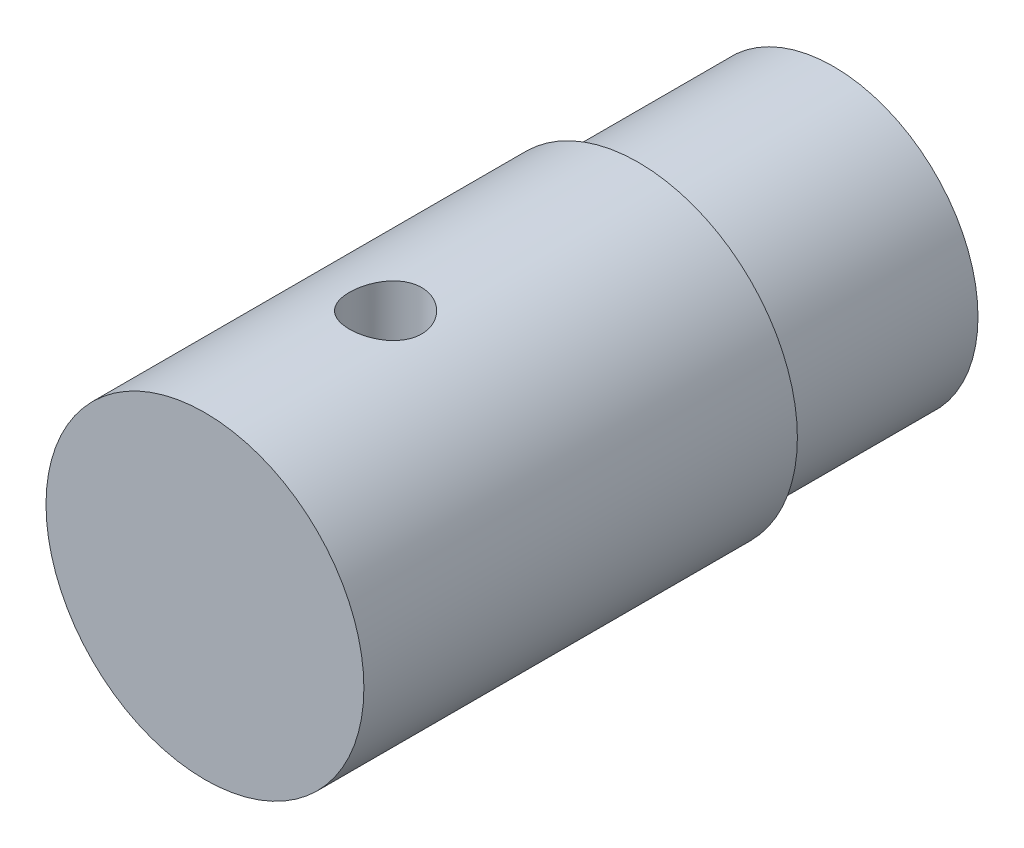
from build123d import *

# Parameters (mm, degrees)
SKETCH1_R                   = 10
BOSS_EXTRUDE1_DEPTH         = 13.5
SKETCH2_R                   = 11
BOSS_EXTRUDE2_DEPTH         = 30
CUT_EXTRUDE3_DEPTH          = 47.197943677
CUT_EXTRUDE3_DEPTH_BACK     = 47.197943677
SKETCH5_R                   = 2.5
SKETCH6_R                   = 2.5
SKETCH6_R_2                 = 2
BOSS_EXTRUDE3_DEPTH         = 6
CUT_EXTRUDE4_DEPTH          = 25
TAP_DRILL_FOR_M3_TAP1_D     = 2.5
TAP_DRILL_FOR_M3_TAP1_DEPTH = 25
TAP_DRILL_FOR_M3_TAP1_TIP   = 0.751075774


with BuildPart() as part:
    # Sketch1 → Boss-Extrude1 (new body)
    with BuildSketch(Plane.XY):
        Circle(SKETCH1_R)
    extrude(amount=BOSS_EXTRUDE1_DEPTH)

    # Sketch2 → Boss-Extrude2 (add)
    with BuildSketch(Plane.XY.offset(13.5)):
        Circle(SKETCH2_R)
    extrude(amount=BOSS_EXTRUDE2_DEPTH)

    # Sketch5 → Cut-Extrude3 (cut, two sides: drawn at the far end of the back side and taken through both)
    with BuildSketch(Plane(origin=(0, 0, 0), x_dir=(1, 0, 0), z_dir=(0, 1, 0)).offset(-CUT_EXTRUDE3_DEPTH_BACK)):
        with Locations((0, -31)):
            Circle(SKETCH5_R)
    extrude(amount=CUT_EXTRUDE3_DEPTH + CUT_EXTRUDE3_DEPTH_BACK, mode=Mode.SUBTRACT)

    # Sketch6 → Boss-Extrude3 (add, symmetric)
    with BuildSketch(Plane(origin=(0, 0, 0), x_dir=(1, 0, 0), z_dir=(0, 1, 0))):
        with Locations((0, -31)):
            Circle(SKETCH6_R)
        with Locations((0, -31)):
            Circle(SKETCH6_R_2, mode=Mode.SUBTRACT)
    extrude(amount=BOSS_EXTRUDE3_DEPTH, both=True)

    # Sketch7 → Cut-Extrude4 (cut)
    with BuildSketch(Plane(origin=(0, 0, 0), x_dir=(-1, 0, 0), z_dir=(0, 0, -1))):
        with BuildLine():
            Line((-1, 4), (-1, 2.828427125))
            ThreePointArc((-1, 2.828427125), (0, -3), (1, 2.828427125))
            Line((1, 2.828427125), (1, 4))
            Line((1, 4), (-1, 4))
        make_face()
    extrude(amount=-CUT_EXTRUDE4_DEPTH, mode=Mode.SUBTRACT)

    # Tap Drill for M3 Tap1
    with Locations(Plane(origin=(0, 0, 0), x_dir=(-1, 0, 0), z_dir=(0, 0, -1))):
        with Locations((-5.303300859, -5.303300859), (-5.303300859, 5.303300859), (5.303300859, 5.303300859), (5.303300859, -5.303300859)):
            Hole(TAP_DRILL_FOR_M3_TAP1_D / 2, depth=TAP_DRILL_FOR_M3_TAP1_DEPTH)
            with Locations((0, 0, -(TAP_DRILL_FOR_M3_TAP1_DEPTH + TAP_DRILL_FOR_M3_TAP1_TIP / 2))):  # 118° drill point
                Cone(0, TAP_DRILL_FOR_M3_TAP1_D / 2, TAP_DRILL_FOR_M3_TAP1_TIP, mode=Mode.SUBTRACT)


solid = part.part
